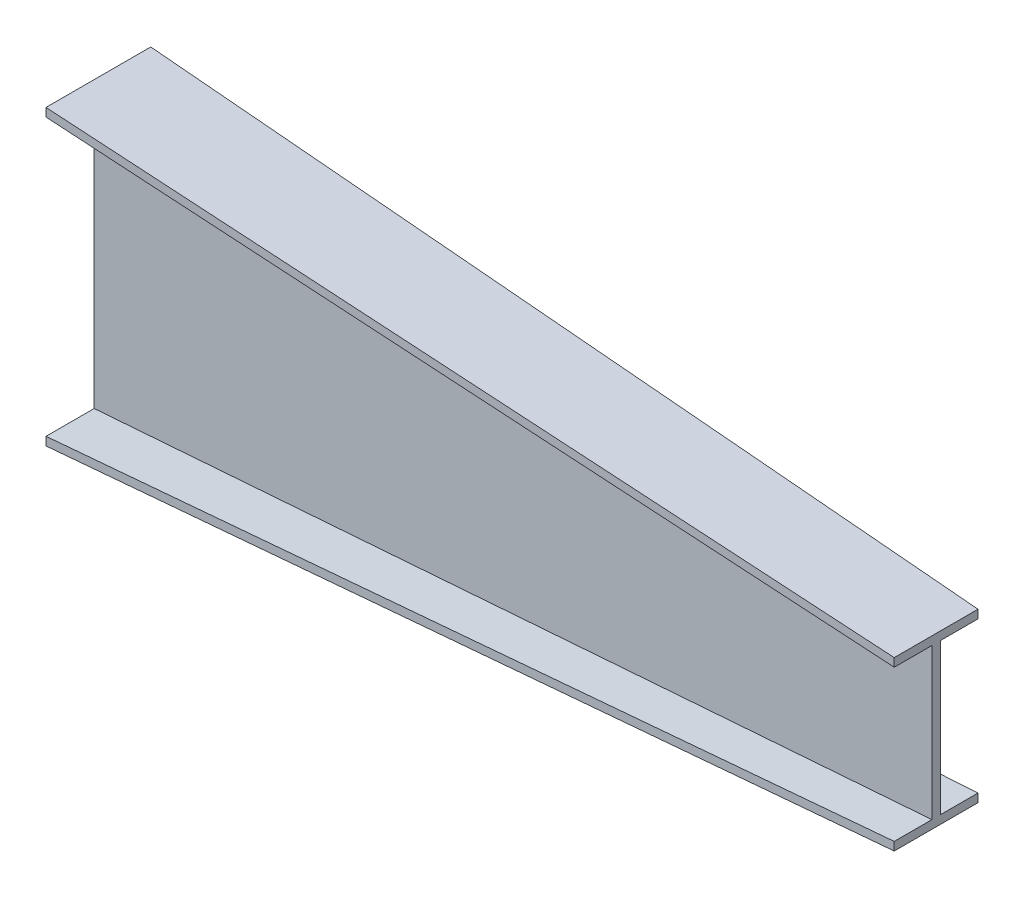
from build123d import *


with BuildPart() as part:
    # Sketch1 → Loft l4 section 0
    with BuildSketch(Plane(origin=(0, 0, 0), x_dir=(0, 0, -1), z_dir=(1, 0, 0))):
        with BuildLine():
            Line((-67.5, 175), (57.5, 175))
            Line((57.5, 175), (57.5, 165))
            Line((57.5, 165), (0, 165))
            Line((0, 165), (0, -165))
            Line((0, -165), (57.5, -165))
            Line((57.5, -165), (57.5, -175))
            Line((57.5, -175), (-67.5, -175))
            Line((-67.5, -175), (-67.5, -165))
            Line((-67.5, -165), (-10, -165))
            Line((-10, -165), (-10, 165))
            Line((-10, 165), (-67.5, 165))
            Line((-67.5, 165), (-67.5, 175))
        make_face()
    # Sketch4 → Loft l4 section 1
    with BuildSketch(Plane(origin=(1000, 0, -1000), x_dir=(0, 0, 1), z_dir=(-1, 0, 0))):
        with BuildLine():
            Line((955, 100), (1055, 100))
            Line((1055, 100), (1055, 90))
            Line((1055, 90), (1010, 90))
            Line((1010, 90), (1010, -90))
            Line((1010, -90), (1055, -90))
            Line((1055, -90), (1055, -100))
            Line((1055, -100), (955, -100))
            Line((955, -100), (955, -90))
            Line((955, -90), (1000, -90))
            Line((1000, -90), (1000, 90))
            Line((1000, 90), (955, 90))
            Line((955, 90), (955, 100))
        make_face()
    loft()


solid = part.part
